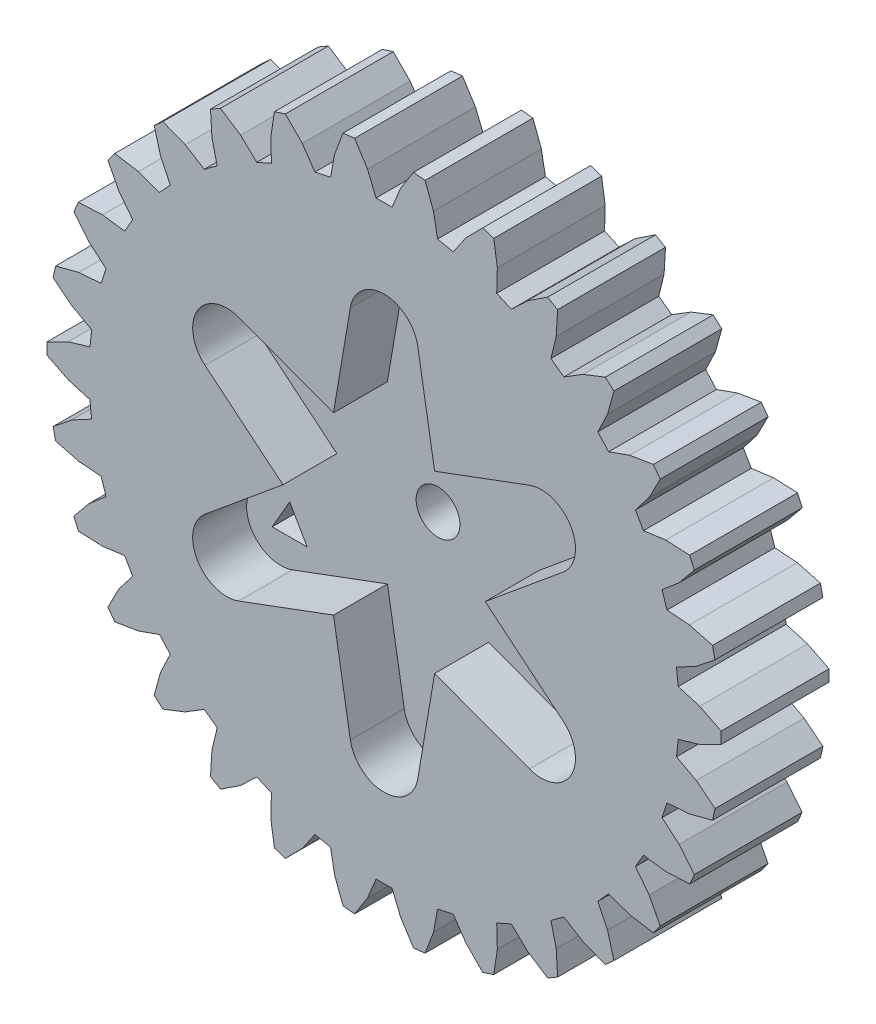
from build123d import *

# Parameters (mm, degrees)
BOSS_EXTRUDE1_DEPTH = 8
CUT_EXTRUDE4_DEPTH  = 4
SKETCH5_R           = 1.625
CUT_EXTRUDE5_DEPTH  = 114.938091431
SKETCH7_R           = 2.875
CUT_EXTRUDE6_DEPTH  = 1.5
CUT_EXTRUDE7_DEPTH  = 114.938091431


with BuildPart() as part:
    # Sketch1 → Boss-Extrude1 (new body)
    with BuildSketch(Plane.XY):
        Polygon((67.838691437, 65.517866318), (69.4350027, 65.049749419), (71.026159174, 64.251961707), (71.026159174, 63.394033481), (69.4350027, 62.596245769), (67.838691437, 62.12812887), (67.714359377, 60.945685054), (69.178606177, 60.155998099), (70.569088563, 59.044741521), (70.390752331, 58.205591984), (68.668390309, 57.75600806), (67.009606199, 57.630080376), (66.642255801, 56.499308835), (67.91024703, 55.42254103), (69.039300308, 54.046418819), (68.690360246, 53.262746436), (66.912276224, 53.181003905), (65.263556413, 53.40278858), (64.669020401, 52.373151894), (65.685401977, 51.056188644), (66.503808846, 49.475342184), (65.999484477, 48.781390015), (64.243247317, 49.071170681), (62.676638392, 49.630849566), (61.881060372, 48.747269162), (62.601400993, 47.247796879), (63.073200133, 45.531449431), (62.435706672, 44.957410372), (60.778026756, 45.60595012), (59.362138343, 46.47909787), (58.400251933, 45.780236192), (58.793008793, 44.163795895), (58.89770325, 42.386816503), (58.154779059, 41.957852172), (56.668193967, 42.936921648), (55.464639564, 44.08536725), (54.378544169, 43.601785548), (54.426656842, 41.938950842), (54.159581951, 40.179154516), (53.343629619, 39.914043603), (52.093189812, 41.180807128), (51.154746322, 42.554351727), (49.99181747, 42.307160589), (49.693199773, 40.670591694), (49.066015892, 39.004811457), (48.21275146, 38.915090809), (47.252951668, 40.414194737), (46.620736072, 41.952820022), (45.431664484, 41.952820022), (44.799448453, 40.414194737), (43.839648661, 38.915090809), (42.986384664, 39.004811457), (42.359200783, 40.670591694), (42.060582651, 42.307160589), (40.897654234, 42.554351727), (39.959210744, 41.180807128), (38.708770937, 39.914043603), (37.89281817, 40.179154516), (37.625743714, 41.938950842), (37.673856387, 43.601785548), (36.587760557, 44.08536725), (35.384206154, 42.936921648), (33.897621497, 41.957852172), (33.154697306, 42.386816503), (33.259391328, 44.163795895), (33.652148188, 45.780236192), (32.690262213, 46.47909787), (31.274373365, 45.60595012), (29.616693883, 44.957410372), (28.979200423, 45.531449431), (29.450999563, 47.247796879), (30.171340183, 48.747269162), (29.375762164, 49.630849566), (27.809152804, 49.071170681), (26.052915644, 48.781390015), (25.548591275, 49.475342184), (26.366998579, 51.056188644), (27.38337972, 52.373151894), (26.788844143, 53.40278858), (25.140124332, 53.181003905), (23.362039875, 53.262746436), (23.013100248, 54.046418819), (24.142153526, 55.42254103), (25.410144754, 56.499308835), (25.042794357, 57.630080376), (23.384009811, 57.75600806), (21.661648225, 58.205591984), (21.483311993, 59.044741521), (22.873793943, 60.155998099), (24.338041179, 60.945685054), (24.213708684, 62.12812887), (22.617397421, 62.596245769), (21.026240947, 63.394033481), (21.026240947, 64.251961707), (22.617397421, 65.049749419), (24.213708684, 65.517866318), (24.338041179, 66.700310134), (22.873793943, 67.489997089), (21.483311993, 68.601253667), (21.661648225, 69.440403204), (23.384009811, 69.889987128), (25.042794357, 70.015914812), (25.410144754, 71.146686788), (24.142153526, 72.223454158), (23.013100248, 73.599576369), (23.362039875, 74.383249187), (25.140124332, 74.464991718), (26.788844143, 74.243206608), (27.38337972, 75.272843294), (26.366998579, 76.589806544), (25.548591275, 78.170653004), (26.052915644, 78.864605173), (27.809152804, 78.574824507), (29.375762164, 78.015145622), (30.171340183, 78.898726027), (29.450999563, 80.398198309), (28.979200423, 82.114546192), (29.616693883, 82.688584816), (31.274373365, 82.040045068), (32.690262213, 81.166897318), (33.652148188, 81.865758997), (33.259391328, 83.482199293), (33.154697306, 85.259178685), (33.897621497, 85.688143016), (35.384206154, 84.70907354), (36.587760557, 83.560627938), (37.673856387, 84.04420964), (37.625743714, 85.707044346), (37.89281817, 87.466840672), (38.708770937, 87.731951585), (39.959210744, 86.465188061), (40.897654234, 85.091643462), (42.060582651, 85.338834599), (42.359200783, 86.975403494), (42.986384664, 88.641183731), (43.839648661, 88.730904379), (44.799448453, 87.231800451), (45.431664484, 85.693175166), (46.620736072, 85.693175166), (47.252951668, 87.231800451), (48.21275146, 88.730904379), (49.066015892, 88.641183731), (49.693199773, 86.975403494), (49.99181747, 85.338834599), (51.154746322, 85.091643462), (52.093189812, 86.465188061), (53.343629619, 87.731951585), (54.159581951, 87.466840672), (54.426656842, 85.707044346), (54.378544169, 84.04420964), (55.464639564, 83.560627938), (56.668193967, 84.70907354), (58.154779059, 85.688143016), (58.89770325, 85.259178685), (58.793008793, 83.482199293), (58.400251933, 81.865758997), (59.362138343, 81.166897318), (60.778026756, 82.040045068), (62.435706672, 82.688584816), (63.073200133, 82.114546192), (62.601400993, 80.398198309), (61.881060372, 78.898726027), (62.676638392, 78.015145622), (64.243247317, 78.574824507), (65.999484477, 78.864605173), (66.503808846, 78.170653004), (65.685401977, 76.589806544), (64.669020401, 75.272843294), (65.263556413, 74.243206608), (66.912276224, 74.464991718), (68.690360246, 74.383249187), (69.039300308, 73.599576369), (67.91024703, 72.223454158), (66.642255801, 71.146686788), (67.009606199, 70.015914812), (68.668390309, 69.889987128), (70.390752331, 69.440403204), (70.569088563, 68.601253667), (69.178606177, 67.489997089), (67.714359377, 66.700310134), align=None)
    extrude(amount=-BOSS_EXTRUDE1_DEPTH)

    # Sketch4 → Cut-Extrude4 (cut)
    with BuildSketch(Plane.XY):
        with BuildLine():
            Line((42.276200169, 70.318188122), (43.526200169, 77.710256367))
            ThreePointArc((43.526200169, 77.710256367), (46.026200169, 79.822997594), (48.526200169, 77.710256367))
            Line((48.526200169, 77.710256367), (49.776200169, 70.318188122))
            Line((49.776200169, 70.318188122), (56.802919056, 72.93169049))
            ThreePointArc((56.802919056, 72.93169049), (59.88260663, 71.822997594), (59.302919056, 68.601563471))
            Line((59.302919056, 68.601563471), (53.526200169, 63.822997594))
            Line((53.526200169, 63.822997594), (59.302919056, 59.044431717))
            ThreePointArc((59.302919056, 59.044431717), (59.88260663, 55.822997594), (56.802919056, 54.714304698))
            Line((56.802919056, 54.714304698), (49.776200169, 57.327807066))
            Line((49.776200169, 57.327807066), (48.526200169, 49.935738821))
            ThreePointArc((48.526200169, 49.935738821), (46.026200169, 47.822997594), (43.526200169, 49.935738821))
            Line((43.526200169, 49.935738821), (42.276200169, 57.327807066))
            Line((42.276200169, 57.327807066), (35.249481283, 54.714304698))
            ThreePointArc((35.249481283, 54.714304698), (32.169793709, 55.822997594), (32.749481283, 59.044431717))
            Line((32.749481283, 59.044431717), (38.526200169, 63.822997594))
            Line((38.526200169, 63.822997594), (32.749481283, 68.601563471))
            ThreePointArc((32.749481283, 68.601563471), (32.169793709, 71.822997594), (35.249481283, 72.93169049))
            Line((35.249481283, 72.93169049), (42.276200169, 70.318188122))
        make_face()
    extrude(amount=-CUT_EXTRUDE4_DEPTH, mode=Mode.SUBTRACT)

    # Sketch5 → Cut-Extrude5 (cut, through all)
    with BuildSketch(Plane.XY):
        with Locations((46.026200169, 63.822997594)):
            Circle(SKETCH5_R)
    extrude(amount=-CUT_EXTRUDE5_DEPTH, mode=Mode.SUBTRACT)

    # Sketch7 → Cut-Extrude6 (cut)
    with BuildSketch(Plane(origin=(0, 0, -8), x_dir=(-1, 0, 0), z_dir=(0, 0, -1))):
        with Locations((-46.026200169, 63.822997594)):
            Circle(SKETCH7_R)
    extrude(amount=-CUT_EXTRUDE6_DEPTH, mode=Mode.SUBTRACT)

    # Sketch9 → Cut-Extrude7 (cut, through all)
    with BuildSketch(Plane.XY):
        Polygon((57.024722797, 58.972997594), (55.725684692, 56.722997594), (58.323760903, 56.722997594), align=None)
        Polygon((47.325238275, 75.772997594), (46.026200169, 78.022997594), (44.727162064, 75.772997594), align=None)
        Polygon((36.326715647, 56.722997594), (35.027677541, 58.972997594), (33.728639435, 56.722997594), align=None)
    extrude(amount=-CUT_EXTRUDE7_DEPTH, mode=Mode.SUBTRACT)


solid = part.part
